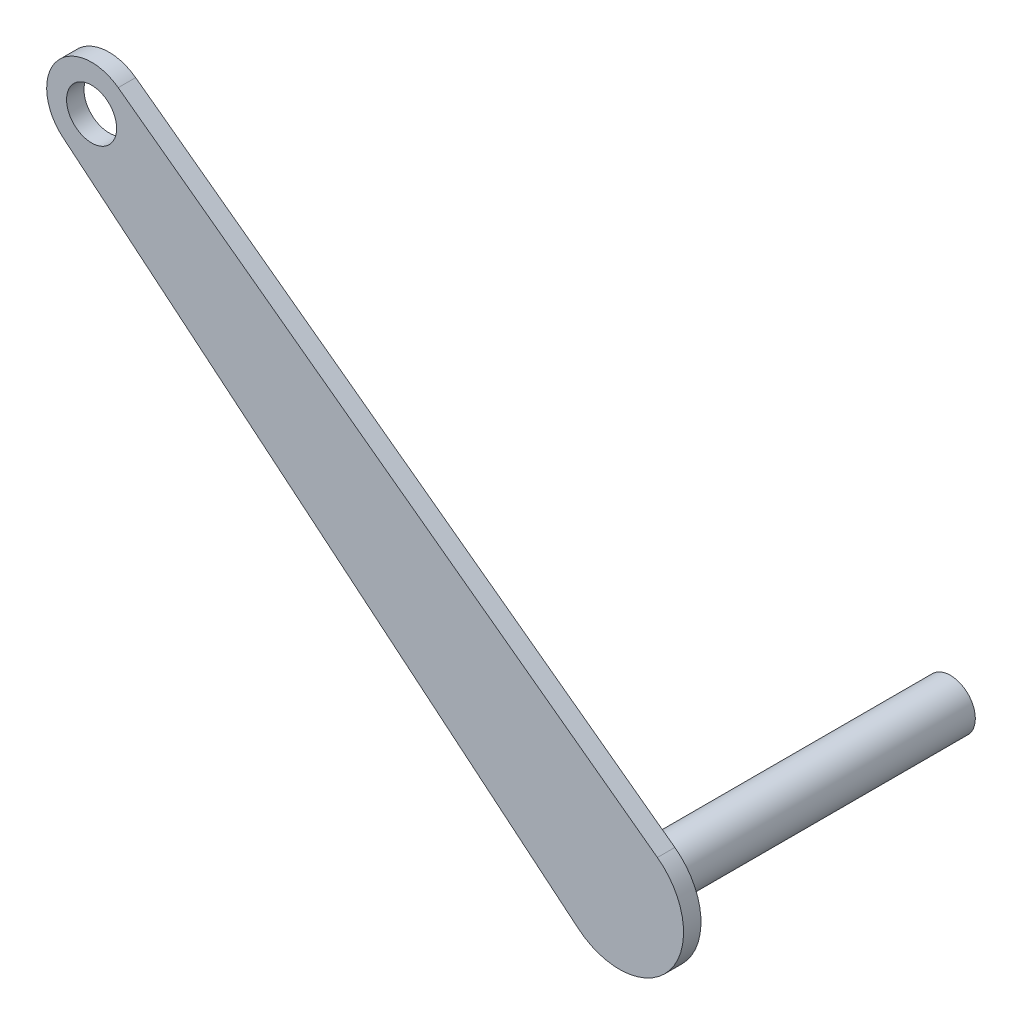
from build123d import *

# Parameters (mm, degrees)
EXTRUDE1_OUTLINE_R = 4.309736146
EXTRUDE1_DEPTH     = 3
EXTRUDE2_START     = -57
SKETCH2_R          = 4.309736146
EXTRUDE2_DEPTH     = 57


# Read off the part's stored shape, not the designer's step: Extrude1
with BuildPart() as part:
    # Extrude1 outline → Extrude1 (new body)
    with BuildSketch(Plane.XY):
        with BuildLine():
            ThreePointArc((-11.990836263, 60.528054794), (-22.672294112, 59.063871996), (-21.516296681, 48.344681589))
            Line((-21.516296681, 48.344681589), (67.256693566, -25.277180433))
            ThreePointArc((67.256693566, -25.277180433), (83.02731963, -23.576417361), (80.873138344, -7.861305383))
            Line((80.873138344, -7.861305383), (-11.990836263, 60.528054794))
        make_face()
        with Locations((74.315769624, -16.765370586)):
            Circle(EXTRUDE1_OUTLINE_R, mode=Mode.SUBTRACT)
        with Locations((-16.578080379, 54.299165973)):
            Circle(EXTRUDE1_OUTLINE_R, mode=Mode.SUBTRACT)
    extrude(amount=EXTRUDE1_DEPTH)

    # Sketch2 → Extrude2 (add)
    with BuildSketch(Plane.XY.offset(3).offset(EXTRUDE2_START)):
        with Locations((74.315769624, -16.765370586)):
            Circle(SKETCH2_R)
    extrude(amount=EXTRUDE2_DEPTH)


solid = part.part
